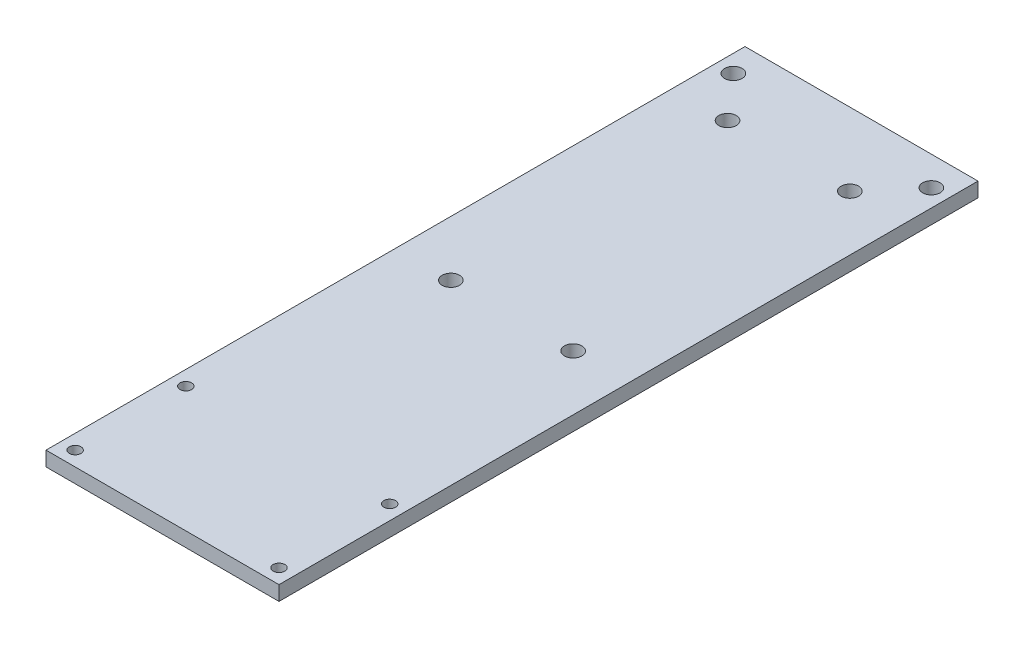
from build123d import *

# Parameters (mm, degrees)
PLATE_SKETCH_W        = 80
PLATE_SKETCH_H        = 240
PLATE_EXTRUDE_DEPTH   = 5
F_6_0MM_DOWEL_HOLE2_D = 6
F_4_0MM_DOWEL_HOLE1_D = 4
F_6_0MM_DOWEL_HOLE1_D = 6


with BuildPart() as part:
    # Plate sketch → Plate extrude (new body)
    with BuildSketch(Plane(origin=(0, 0, 0), x_dir=(1, 0, 0), z_dir=(0, 1, 0))):
        Rectangle(PLATE_SKETCH_W, PLATE_SKETCH_H)
    extrude(amount=PLATE_EXTRUDE_DEPTH)

    # Ø6.0mm Dowel Hole2 (through all)
    with Locations(Plane(origin=(0, 5, 0), x_dir=(1, 0, 0), z_dir=(0, 1, 0))):
        with Locations((-21, 95), (21, 0), (-21, 0), (21, 95)):
            Hole(F_6_0MM_DOWEL_HOLE2_D / 2)

    # Ø4.0mm Dowel Hole1 (through all)
    with Locations(Plane(origin=(0, 5, 0), x_dir=(1, 0, 0), z_dir=(0, 1, 0))):
        with Locations((35, -77), (-35, -77), (-35, -115), (35, -115)):
            Hole(F_4_0MM_DOWEL_HOLE1_D / 2)

    # Ø6.0mm Dowel Hole1 (through all)
    with Locations(Plane(origin=(0, 5, 0), x_dir=(1, 0, 0), z_dir=(0, 1, 0))):
        with Locations((-34, 110), (34, 110)):
            Hole(F_6_0MM_DOWEL_HOLE1_D / 2)


solid = part.part
